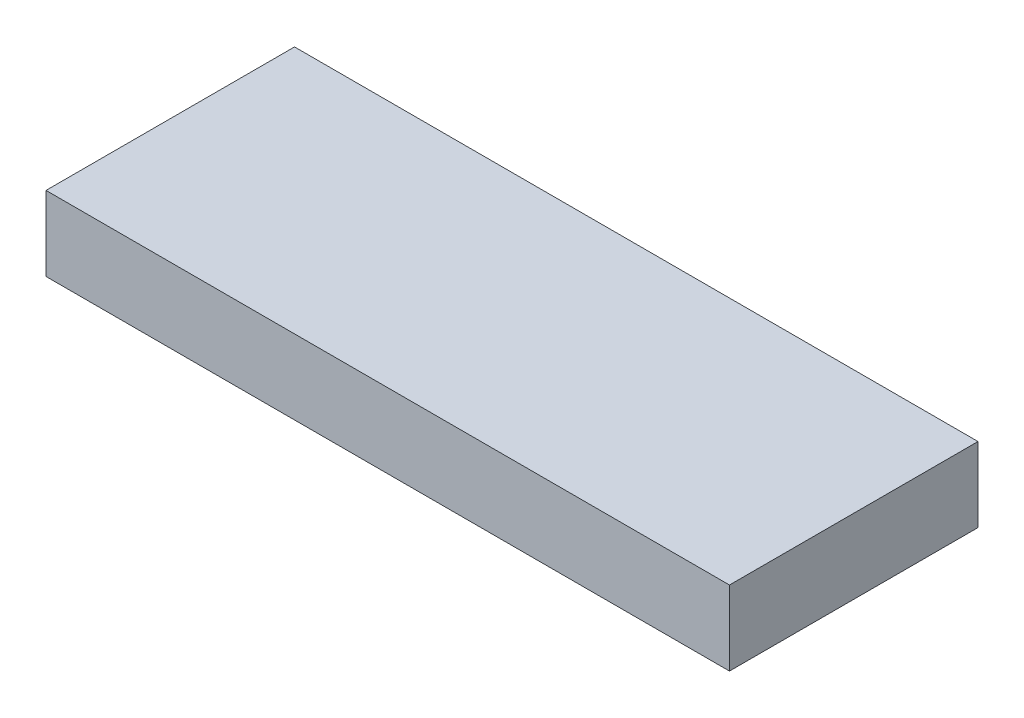
from build123d import *

# Parameters (mm, degrees)
SKETCH1_W           = 55
SKETCH1_H           = 20
BOSS_EXTRUDE1_DEPTH = 6


with BuildPart() as part:
    # Sketch1 → Boss-Extrude1 (new body)
    with BuildSketch(Plane(origin=(0, 0, 0), x_dir=(1, 0, 0), z_dir=(0, 1, 0))):
        Rectangle(SKETCH1_W, SKETCH1_H)
    extrude(amount=BOSS_EXTRUDE1_DEPTH)


solid = part.part
